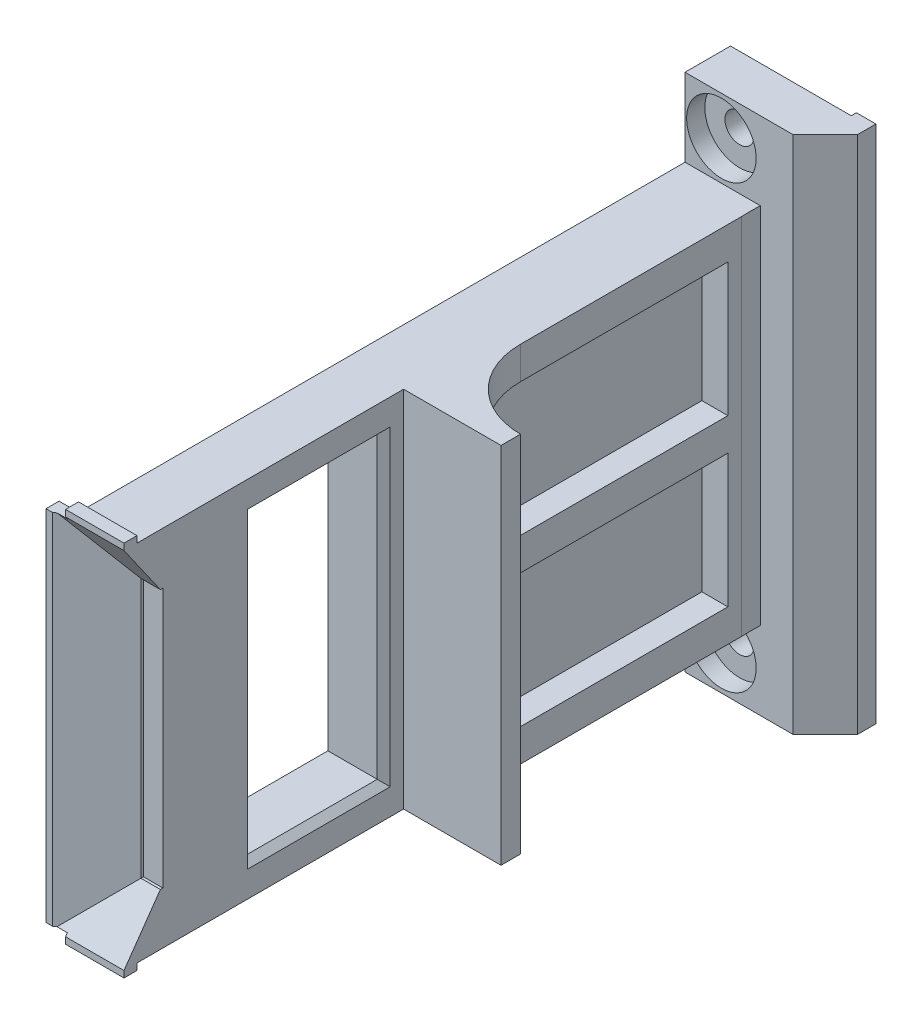
from build123d import *
from OCP.BRepFilletAPI import BRepFilletAPI_MakeChamfer

# Parameters (mm, degrees)
SKETCH_1_W          = 12
SKETCH_1_H          = 46
EXTRUDE_1_DEPTH     = 59
SKETCH_2_W          = 20
SKETCH_2_H          = 46.080872769
CUT_EXTRUDE_1_DEPTH = 60
SKETCH_3_W          = 12
SKETCH_3_H          = 59
EXTRUDE_2_DEPTH     = 5
SKETCH_4_W          = 12
SKETCH_4_H          = 56
EXTRUDE_3_DEPTH     = 40
SKETCH_5_W          = 12
SKETCH_5_H          = 7
EXTRUDE_4_DEPTH     = 12
M4_A_1_D            = 4.5
M4_A_1_CBORE_D      = 10.705
M4_A_1_CBORE_DEPTH  = 2.8
SKETCH_8_W          = 15
SKETCH_8_H          = 56
EXTRUDE_5_DEPTH     = 3
SKETCH_9_W          = 6
SKETCH_9_H          = 40
CUT_EXTRUDE_2_DEPTH = 6
CHAMFER_1_SIZE      = 8
CHAMFER_1_SIZE_2    = 5.601660306
SKETCH_10_W         = 6
SKETCH_10_H         = 39.2
EXTRUDE_6_DEPTH     = 9
SKETCH_11_W         = 3
SKETCH_11_H         = 0.4
CUT_EXTRUDE_3_DEPTH = 119.330046903
CHAMFER_2_SIZE      = 1
CHAMFER_3_SIZE      = 2
CHAMFER_3_SIZE2     = 1.400415076
SKETCH_12_W         = 45
SKETCH_12_H         = 20.5
CUT_EXTRUDE_4_DEPTH = 4
SKETCH_14_W         = 7
SKETCH_14_H         = 80
EXTRUDE_7_DEPTH     = 10
CUT_EXTRUDE_5_DEPTH = 103.46950766
SKETCH_16_W         = 3
SKETCH_16_H         = 56
EXTRUDE_8_DEPTH     = 12
CHAMFER_5_SIZE      = 5
CUT_EXTRUDE_START   = -43.060641
SKETCH_17_W         = 3
SKETCH_17_H         = 56
CUT_EXTRUDE_6_DEPTH = 43.060641
CHAMFER_4_SIZE      = 1
FILLET_1_R          = 12
SKETCH_22_W         = 3
SKETCH_22_H         = 80
EXTRUDE_11_DEPTH    = 0.8
SKETCH_24_W         = 9
SKETCH_24_H         = 2
EXTRUDE_13_DEPTH    = 1
SKETCH_26_W         = 99
SKETCH_26_H         = 80
CUT_EXTRUDE_8_DEPTH = 0.4


with BuildPart() as part:
    # 스케치1 → 보스-돌출1 (new body)
    with BuildSketch(Plane.XY):
        Rectangle(SKETCH_1_W, SKETCH_1_H)
    extrude(amount=EXTRUDE_1_DEPTH)

    # 스케치2 → 컷-돌출1 (cut)
    with BuildSketch(Plane(origin=(6, 0, 0), x_dir=(0, 0, -1), z_dir=(1, 0, 0))):
        with Locations((-32, 0.040436385)):
            Rectangle(SKETCH_2_W, SKETCH_2_H)
    extrude(amount=-CUT_EXTRUDE_1_DEPTH, mode=Mode.SUBTRACT)


with BuildPart() as cut_extrude_1_piece_1:
    # of the separate pieces the step leaves, piece 1, a body of its own (cut_extrude_1_pieces)
    add(part.part.solids().sort_by_distance((-6, 23, 0))[0])



with BuildPart() as cut_extrude_1_piece_2:
    # of the separate pieces the step leaves, piece 2, a body of its own (cut_extrude_1_pieces)
    add(part.part.solids().sort_by_distance((6, 23, 42))[0])


with BuildPart() as cut_extrude_1_piece_1_1:
    add(cut_extrude_1_piece_1.part)

    add(cut_extrude_1_piece_2.part)  # 보스-돌출2 merges 컷-돌출1 piece 2
    # 스케치3 → 보스-돌출2 (add)
    with BuildSketch(Plane.XZ.offset(23)):
        with Locations((0, 29.5)):
            Rectangle(SKETCH_3_W, SKETCH_3_H)
    extrude_2 = extrude(amount=EXTRUDE_2_DEPTH)

    # 대칭 복사1: 보스-돌출2 across plane
    add(extrude_2.mirror(Plane.ZX))

    # 스케치4 → 보스-돌출3 (add)
    with BuildSketch(Plane(origin=(0, 0, 0), x_dir=(-1, 0, 0), z_dir=(0, 0, -1))):
        Rectangle(SKETCH_4_W, SKETCH_4_H)
    extrude(amount=EXTRUDE_3_DEPTH)

    # 스케치5 → 보스-돌출4 (add)
    with BuildSketch(Plane.XZ.offset(28)):
        with Locations((0, -36.5)):
            Rectangle(SKETCH_5_W, SKETCH_5_H)
    extrude_4 = extrude(amount=EXTRUDE_4_DEPTH)

    # 대칭 복사2: 보스-돌출4 across plane
    add(extrude_4.mirror(Plane.ZX))

    # M4 육각 머리 볼트용 카운터보어 (A 등급)1 (through all)
    with Locations(Plane.XY.offset(-33)):
        with Locations((0, -34), (0, 34)):
            CounterBoreHole(M4_A_1_D / 2, M4_A_1_CBORE_D / 2, M4_A_1_CBORE_DEPTH)

    # 스케치8 → 보스-돌출5 (add)
    with BuildSketch(Plane.XY.offset(59)):
        with Locations((-1.5, 0)):
            Rectangle(SKETCH_8_W, SKETCH_8_H)
    extrude(amount=EXTRUDE_5_DEPTH)

    # 스케치9 → 컷-돌출2 (cut)
    with BuildSketch(Plane.XY.offset(62)):
        with Locations((3, 0)):
            Rectangle(SKETCH_9_W, SKETCH_9_H)
    extrude(amount=-CUT_EXTRUDE_2_DEPTH, mode=Mode.SUBTRACT)

    # 모따기1
    chamfer_1_edges_1 = [cut_extrude_1_piece_1_1.edges().sort_by_distance(p)[0] for p in [
        (0, 0, 62),
    ]]
    chamfer_1_side_1 = [cut_extrude_1_piece_1_1.faces().sort_by_distance(p)[0] for p in [
        (-0.112033206, 0, 62),
    ]]
    chamfer_1_edges_2 = [cut_extrude_1_piece_1_1.edges().sort_by_distance(p)[0] for p in [
        (3, 20, 62),
    ]]
    chamfer_1_side_2 = [cut_extrude_1_piece_1_1.faces().sort_by_distance(p)[0] for p in [
        (3, 20.112033206, 62),
    ]]
    chamfer_1_edges_3 = [cut_extrude_1_piece_1_1.edges().sort_by_distance(p)[0] for p in [
        (3, -20, 62),
    ]]
    chamfer_1_side_3 = [cut_extrude_1_piece_1_1.faces().sort_by_distance(p)[0] for p in [
        (3, -20.112033206, 62),
    ]]
    chamfer_1 = BRepFilletAPI_MakeChamfer(cut_extrude_1_piece_1_1.part.solid().wrapped)
    for e in chamfer_1_edges_1:
        chamfer_1.Add(CHAMFER_1_SIZE - 0.0001, CHAMFER_1_SIZE_2 - 0.0001, e.wrapped, chamfer_1_side_1[0].wrapped)
    for e in chamfer_1_edges_2:
        chamfer_1.Add(CHAMFER_1_SIZE - 0.0001, CHAMFER_1_SIZE_2 - 0.0001, e.wrapped, chamfer_1_side_2[0].wrapped)
    for e in chamfer_1_edges_3:
        chamfer_1.Add(CHAMFER_1_SIZE - 0.0001, CHAMFER_1_SIZE_2 - 0.0001, e.wrapped, chamfer_1_side_3[0].wrapped)
    add(Compound.cast(chamfer_1.Shape()), mode=Mode.REPLACE)  # a hair under: the kernel refuses the full size

    # 스케치10 → 보스-돌출6 (add)
    with BuildSketch(Plane(origin=(0, 0, -40), x_dir=(-1, 0, 0), z_dir=(0, 0, -1))):
        with Locations((-3, 0)):
            Rectangle(SKETCH_10_W, SKETCH_10_H)
    extrude(amount=EXTRUDE_6_DEPTH)

    # 스케치11 → 컷-돌출3 (cut, through all)
    with BuildSketch(Plane.XY.offset(62)):
        with Locations((-7.5, 27.8)):
            Rectangle(SKETCH_11_W, SKETCH_11_H)
        with Locations((-7.5, -27.8)):
            Rectangle(SKETCH_11_W, SKETCH_11_H)
    extrude(amount=-CUT_EXTRUDE_3_DEPTH, mode=Mode.SUBTRACT)


with BuildPart() as cut_extrude_3_kept_piece:
    # of the separate pieces the step leaves, the one the design keeps (cut_extrude_3_pieces_kept)
    add(cut_extrude_1_piece_1_1.part.solids().sort_by_distance((6, -27.9999, 62))[0])

    # 모따기2
    chamfer_2_edges = [cut_extrude_3_kept_piece.edges().sort_by_distance(p)[0] for p in [
        (-7.5, -27.6, 59),
        (-7.5, 27.6, 59),
    ]]
    chamfer(chamfer_2_edges, length=CHAMFER_2_SIZE)

    # 모따기3: one chamfer whose edges measure the first distance from different faces: ONE call of the kernel's chamfer builder (chamfer() names one face for all edges)
    chamfer_3_edges_1 = [cut_extrude_3_kept_piece.edges().sort_by_distance(p)[0] for p in [
        (6, 0, -49),
    ]]
    chamfer_3_side_1 = [cut_extrude_3_kept_piece.faces().sort_by_distance(p)[0] for p in [
        (6, 0, -1.052959329),
    ]]
    chamfer_3_edges_2 = [cut_extrude_3_kept_piece.edges().sort_by_distance(p)[0] for p in [
        (3, -19.6, -49),
    ]]
    chamfer_3_side_2 = [cut_extrude_3_kept_piece.faces().sort_by_distance(p)[0] for p in [
        (3, -19.6, -44.5),
    ]]
    chamfer_3_edges_3 = [cut_extrude_3_kept_piece.edges().sort_by_distance(p)[0] for p in [
        (0, 0, -49),
    ]]
    chamfer_3_side_3 = [cut_extrude_3_kept_piece.faces().sort_by_distance(p)[0] for p in [
        (0, 0, -44.5),
    ]]
    chamfer_3_edges_4 = [cut_extrude_3_kept_piece.edges().sort_by_distance(p)[0] for p in [
        (3, 19.6, -49),
    ]]
    chamfer_3_side_4 = [cut_extrude_3_kept_piece.faces().sort_by_distance(p)[0] for p in [
        (3, 19.6, -44.5),
    ]]
    chamfer_3 = BRepFilletAPI_MakeChamfer(cut_extrude_3_kept_piece.part.solid().wrapped)
    for e in chamfer_3_edges_1:
        chamfer_3.Add(CHAMFER_3_SIZE, CHAMFER_3_SIZE2, e.wrapped, chamfer_3_side_1[0].wrapped)  # the first distance lies on this face
    for e in chamfer_3_edges_2:
        chamfer_3.Add(CHAMFER_3_SIZE, CHAMFER_3_SIZE2, e.wrapped, chamfer_3_side_2[0].wrapped)  # the first distance lies on this face
    for e in chamfer_3_edges_3:
        chamfer_3.Add(CHAMFER_3_SIZE, CHAMFER_3_SIZE2, e.wrapped, chamfer_3_side_3[0].wrapped)  # the first distance lies on this face
    for e in chamfer_3_edges_4:
        chamfer_3.Add(CHAMFER_3_SIZE, CHAMFER_3_SIZE2, e.wrapped, chamfer_3_side_4[0].wrapped)  # the first distance lies on this face
    add(Compound.cast(chamfer_3.Shape()), mode=Mode.REPLACE)

    # 스케치12 → 컷-돌출4 (cut)
    with BuildSketch(Plane.ZY.offset(6)):
        with Locations((-5.5, 12.75)):
            Rectangle(SKETCH_12_W, SKETCH_12_H)
        with Locations((-5.5, -12.75)):
            Rectangle(SKETCH_12_W, SKETCH_12_H)
    cut_extrude_4 = extrude(amount=-CUT_EXTRUDE_4_DEPTH, mode=Mode.SUBTRACT)

    # 대칭 복사3: 컷-돌출4 across plane
    add(cut_extrude_4.mirror(Plane.ZY), mode=Mode.SUBTRACT)

    # 스케치14 → 보스-돌출7 (add)
    with BuildSketch(Plane(origin=(6, 0, 0), x_dir=(0, 0, -1), z_dir=(1, 0, 0))):
        with Locations((36.5, 0)):
            Rectangle(SKETCH_14_W, SKETCH_14_H)
    extrude(amount=EXTRUDE_7_DEPTH)

    # 스케치15 → 컷-돌출5 (cut, through all)
    with BuildSketch(Plane.XZ.offset(40)):
        with BuildLine():
            Line((6, -33), (16, -33))
            Line((16, -33), (16, -28.353890031))
            add(Edge.make_bspline(
                [(6, -33), (5.579283, -24.005465365), (9.542787604, -28.181394392), (15.145388019, -28.353890031), (16, -28.353890031)],
                knots=[0, 0, 0, 0, 0.752787833, 1, 1, 1, 1], degree=3))
        make_face()
    extrude(amount=-CUT_EXTRUDE_5_DEPTH, mode=Mode.SUBTRACT)

    # 스케치16 → 보스-돌출8 (add)
    with BuildSketch(Plane(origin=(6, 0, 0), x_dir=(0, 0, -1), z_dir=(1, 0, 0))):
        with Locations((-17.43935887, 0)):
            Rectangle(SKETCH_16_W, SKETCH_16_H)
    extrude(amount=EXTRUDE_8_DEPTH)

    # 모따기5
    chamfer_5_edges = [cut_extrude_3_kept_piece.edges().sort_by_distance(p)[0] for p in [
        (16, 0, -33),
    ]]
    chamfer(chamfer_5_edges, length=CHAMFER_5_SIZE)

    # 스케치17 → 컷-돌출6 (cut)
    with BuildSketch(Plane.XY.offset(62).offset(CUT_EXTRUDE_START)):
        with Locations((4.5, 0)):
            Rectangle(SKETCH_17_W, SKETCH_17_H)
    extrude(amount=CUT_EXTRUDE_6_DEPTH, mode=Mode.SUBTRACT)

    # 모따기4
    chamfer_4_edges = [cut_extrude_3_kept_piece.edges().sort_by_distance(p)[0] for p in [
        (3, -23, 32),
        (3, 23, 32),
        (3, 0, 22),
        (3, 0, 42),
    ]]
    chamfer(chamfer_4_edges, length=CHAMFER_4_SIZE)

    # 필렛1
    fillet_1_edges = [cut_extrude_3_kept_piece.edges().sort_by_distance(p)[0] for p in [
        (6, -25.5, 15.93935887),
        (6, 0, 15.93935887),
        (6, 25.5, 15.93935887),
    ]]
    fillet(fillet_1_edges, radius=FILLET_1_R - 0.0001)  # a hair under: the kernel refuses the full size

    # 스케치22 → 보스-돌출11 (add)
    with BuildSketch(Plane(origin=(0, 0, -40), x_dir=(-1, 0, 0), z_dir=(0, 0, -1))):
        with Locations((-14.5, 0)):
            Rectangle(SKETCH_22_W, SKETCH_22_H)
    extrude(amount=EXTRUDE_11_DEPTH)

    # 스케치24 → 보스-돌출13 (add)
    with BuildSketch(Plane(origin=(0, 28, 0), x_dir=(1, 0, 0), z_dir=(0, 1, 0))):
        with Locations((-1.5, -61)):
            Rectangle(SKETCH_24_W, SKETCH_24_H)
    extrude_13 = extrude(amount=EXTRUDE_13_DEPTH)

    # 대칭 복사4: 보스-돌출13 across plane
    add(extrude_13.mirror(Plane.ZX))

    # 스케치26 → 컷-돌출8 (cut)
    with BuildSketch(Plane.ZY.offset(6)):
        with Locations((9.5, 0)):
            Rectangle(SKETCH_26_W, SKETCH_26_H)
    extrude(amount=-CUT_EXTRUDE_8_DEPTH, mode=Mode.SUBTRACT)


solid = cut_extrude_3_kept_piece.part
